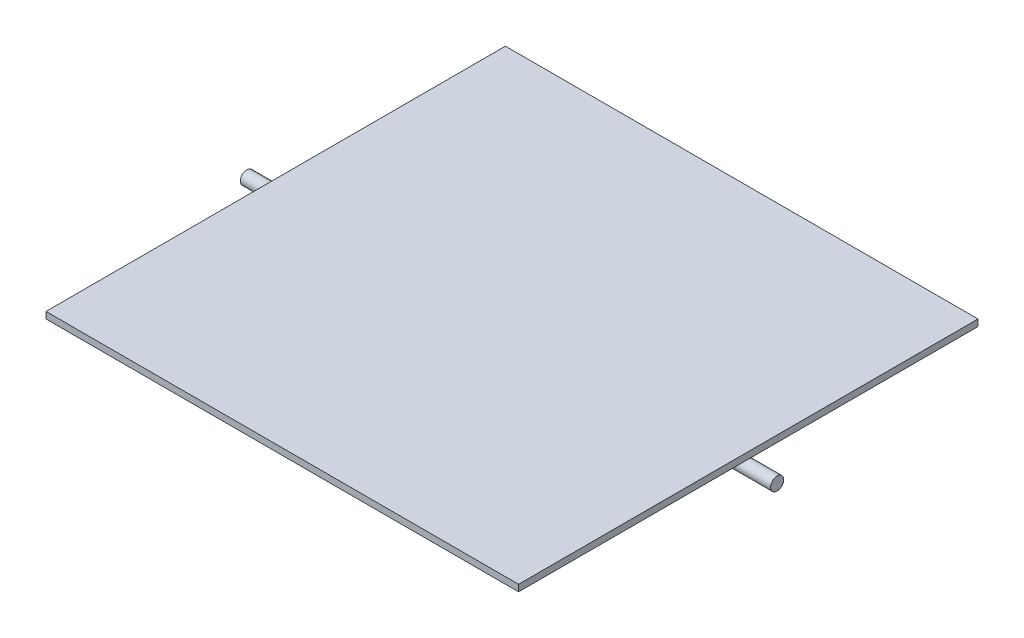
from build123d import *

# Parameters (mm, degrees)
ESQUISSE1_W        = 360
ESQUISSE1_H        = 350
BOSS_EXTRU_1_DEPTH = 5
ESQUISSE2_R        = 5
BOSS_EXTRU_2_DEPTH = 202


with BuildPart() as part:
    # Esquisse1 → Boss.-Extru.1 (new body)
    with BuildSketch(Plane(origin=(0, 0, 0), x_dir=(1, 0, 0), z_dir=(0, 1, 0))):
        Rectangle(ESQUISSE1_W, ESQUISSE1_H)
    extrude(amount=BOSS_EXTRU_1_DEPTH)


with BuildPart() as body_2:
    # Esquisse2 → Boss.-Extru.2 (new, symmetric)
    with BuildSketch(Plane(origin=(0, 0, 0), x_dir=(0, 0, -1), z_dir=(1, 0, 0))):
        with Locations((0, -5)):
            Circle(ESQUISSE2_R)
    extrude(amount=BOSS_EXTRU_2_DEPTH, both=True)


solid = Compound([part.part, body_2.part])
